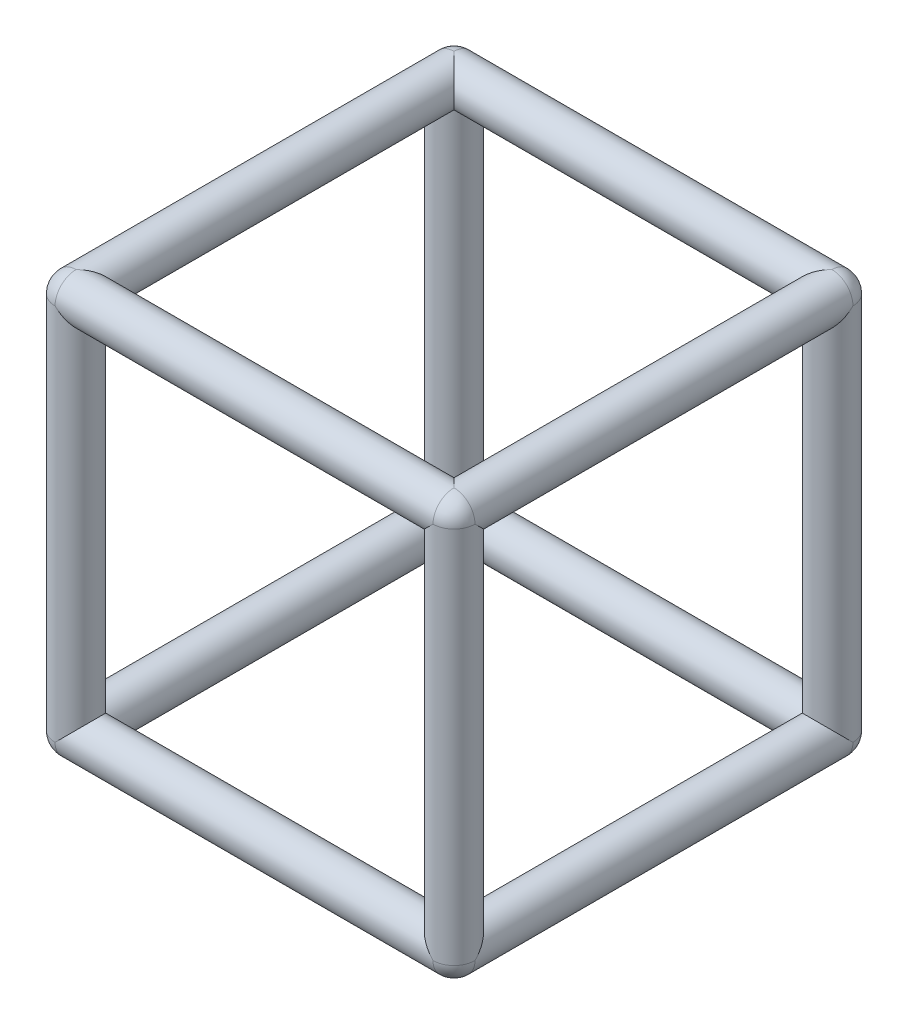
from build123d import *

# Parameters (mm, degrees)
SKETCH5_R            = 12.7
BOSS_EXTRUDE2_DEPTH  = 254
FILLET2_R            = 12.7
LPATTERN1_COUNT      = 2
LPATTERN1_PITCH      = 228.6
LPATTERN1_2_COUNT    = 2
LPATTERN1_2_PITCH    = 228.6
SKETCH6_R            = 12.7
BOSS_EXTRUDE3_DEPTH  = 114.3
LPATTERN2_COUNT      = 2
LPATTERN2_PITCH      = 228.6
LPATTERN2_COUNT_DIR2 = 2
LPATTERN2_PITCH_DIR2 = 228.6
SKETCH8_R            = 12.7
BOSS_EXTRUDE4_DEPTH  = 114.3
LPATTERN3_COUNT      = 2
LPATTERN3_PITCH      = 228.6
LPATTERN3_COUNT_DIR2 = 2
LPATTERN3_PITCH_DIR2 = 228.6


with BuildPart() as part:
    # Sketch5 → Boss-Extrude2 (new body)
    with BuildSketch(Plane(origin=(0, 0, 0), x_dir=(1, 0, 0), z_dir=(0, 1, 0))):
        with Locations(Location((-114.3, 114.3, 0), (0, 0, 270))):
            Circle(SKETCH5_R)
    extrude(amount=BOSS_EXTRUDE2_DEPTH)

    # Fillet2
    fillet2_edges = [part.edges().sort_by_distance(p)[0] for p in [
        (-114.3, 0, -127),
        (-114.3, 254, -127),
    ]]
    fillet(fillet2_edges, radius=FILLET2_R)


with BuildPart() as lpattern1_1:
    # LPattern1: pattern copy
    add(part.part.moved(Location(Vector(1, 0, 0) * (1 * LPATTERN1_PITCH))))


with BuildPart() as lpattern1_2_1:
    # LPattern1 2: pattern copy
    add(part.part.moved(Location(Vector(0, 0, 1) * (1 * LPATTERN1_2_PITCH))))



with BuildPart() as lpattern1_2_2:
    # LPattern1 2: pattern copy
    add(lpattern1_1.part.moved(Location(Vector(0, 0, 1) * (1 * LPATTERN1_2_PITCH))))


with BuildPart() as lpattern1_2_1_1:
    add(lpattern1_2_1.part)

    add(lpattern1_2_2.part)  # Boss-Extrude3 merges LPattern1 2_2
    # Sketch6 → Boss-Extrude3 (add, symmetric)
    with BuildSketch(Plane(origin=(0, 0, 0), x_dir=(0, 0, -1), z_dir=(1, 0, 0))):
        with Locations(Location((-114.3, 241.3, 0), (0, 0, 180))):
            Circle(SKETCH6_R)
    boss_extrude3 = extrude(amount=BOSS_EXTRUDE3_DEPTH, both=True)


with BuildPart() as part_1:
    add(part.part)

    add(lpattern1_1.part)  # LPattern2 merges LPattern1_1

    add(lpattern1_2_1_1.part)  # LPattern2 merges LPattern1 2_1
    # LPattern2: Boss-Extrude3 2 × 2
    with Locations(*[(0, -j * LPATTERN2_PITCH_DIR2, -i * LPATTERN2_PITCH) for i in range(LPATTERN2_COUNT) for j in range(LPATTERN2_COUNT_DIR2) if (i, j) != (0, 0)]):
        add(boss_extrude3)

    # Sketch8 → Boss-Extrude4 (add, symmetric)
    with BuildSketch(Plane.XY):
        with Locations(Location((-114.3, 241.3, 0), (0, 0, 180))):
            Circle(SKETCH8_R)
    boss_extrude4 = extrude(amount=BOSS_EXTRUDE4_DEPTH, both=True)

    # LPattern3: Boss-Extrude4 2 × 2
    with Locations(*[(i * LPATTERN3_PITCH, -j * LPATTERN3_PITCH_DIR2, 0) for i in range(LPATTERN3_COUNT) for j in range(LPATTERN3_COUNT_DIR2) if (i, j) != (0, 0)]):
        add(boss_extrude4)


solid = part_1.part
